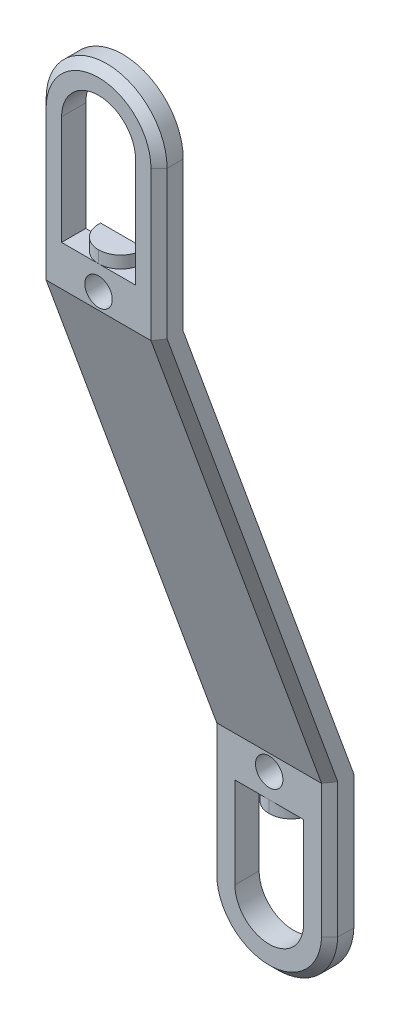
from build123d import *

# Parameters (mm, degrees)
BOSS_EXTRUDE1_DEPTH            = 3
CUT_EXTRUDE1_REACH             = 52.648
SKETCH3_W                      = 5.5
SKETCH3_H                      = 3
BOSS_EXTRUDE2_DEPTH            = 1.5
CUT_EXTRUDE2_REACH             = 52.648
SKETCH4_W                      = 6.851042423
SKETCH4_H                      = 79.503772781
CUT_EXTRUDE2_DIRECTION_2_REACH = 52.648
BOSS_EXTRUDE3_DEPTH            = 7.5
BOSS_EXTRUDE3_DEPTH_BACK       = 7.5
BOSS_EXTRUDE5_DEPTH            = 3
CUT_EXTRUDE3_REACH             = 65.182
SKETCH10_W                     = 5.5
SKETCH10_H                     = 3
BOSS_EXTRUDE6_DEPTH            = 1.5
FILLET2_R                      = 2.75
M3_CLEARANCE_HOLE1_D           = 3.4
M3_CLEARANCE_HOLE1_CSINK_D     = 3.45
M3_CLEARANCE_HOLE1_CSINK_ANGLE = 90
M3_CLEARANCE_HOLE2_D           = 3.4
M3_CLEARANCE_HOLE2_CSINK_D     = 3.45
M3_CLEARANCE_HOLE2_CSINK_ANGLE = 90
CHAMFER2_SIZE                  = 1


with BuildPart() as part:
    # Sketch1 → Boss-Extrude1 (new body)
    with BuildSketch(Plane.XY):
        with BuildLine():
            Line((7.5, 42.5), (7.5, -42.5))
            ThreePointArc((7.5, -42.5), (0, -50), (-7.5, -42.5))
            Line((-7.5, -42.5), (-7.5, 42.5))
            ThreePointArc((-7.5, 42.5), (0, 50), (7.5, 42.5))
        make_face()
    extrude(amount=BOSS_EXTRUDE1_DEPTH)

    # Sketch2 → Cut-Extrude1 (cut, up to next)
    with BuildSketch(Plane.XY.offset(3), mode=Mode.PRIVATE) as cut_extrude1_sk1:
        with BuildLine():
            Line((-4.585044143, 42.5), (-4.585044143, 29))
            Line((-4.585044143, 29), (4.585044143, 29))
            Line((4.585044143, 29), (4.585044143, 42.5))
            ThreePointArc((4.585044143, 42.5), (0, 47.085044143), (-4.585044143, 42.5))
        make_face()
    cut_extrude1_tool1 = extrude(cut_extrude1_sk1.sketch, amount=-CUT_EXTRUDE1_REACH, mode=Mode.PRIVATE) & part.part
    cut_extrude1 = cut_extrude1_tool1.solids().sort_by_distance((0, 37.581163, 3))[0]
    add(cut_extrude1, mode=Mode.SUBTRACT)

    # Sketch3 → Boss-Extrude2 (add)
    with BuildSketch(Plane(origin=(0, 29, 0), x_dir=(1, 0, 0), z_dir=(0, 1, 0))):
        with Locations((0, -1.5)):
            Rectangle(SKETCH3_W, SKETCH3_H)
    boss_extrude2 = extrude(amount=BOSS_EXTRUDE2_DEPTH)

    # Mirror1: Cut-Extrude1, Boss-Extrude2 across plane
    add(cut_extrude1.mirror(Plane.ZX), mode=Mode.SUBTRACT)
    add(boss_extrude2.mirror(Plane.ZX))

    # Sketch4 → Cut-Extrude2 (cut, up to next)
    with BuildSketch(Plane(origin=(0, 0, 0), x_dir=(0, 0, -1), z_dir=(1, 0, 0)), mode=Mode.PRIVATE) as cut_extrude2_sk1:
        with Locations((-3.425521211, -15.751886391)):
            Rectangle(SKETCH4_W, SKETCH4_H)
    cut_extrude2_tool1 = extrude(cut_extrude2_sk1.sketch, amount=-CUT_EXTRUDE2_REACH, mode=Mode.PRIVATE) & part.part
    add(cut_extrude2_tool1.solids().sort_by_distance((0, -15.751886, 3.425521))[0], mode=Mode.SUBTRACT)

    # Sketch4 → Cut-Extrude2 direction 2 (cut, up to next)
    with BuildSketch(Plane(origin=(0, 0, 0), x_dir=(0, 0, -1), z_dir=(1, 0, 0)), mode=Mode.PRIVATE) as cut_extrude2_direction_2_sk1:
        with Locations((-3.425521211, -15.751886391)):
            Rectangle(SKETCH4_W, SKETCH4_H)
    cut_extrude2_direction_2_tool1 = extrude(cut_extrude2_direction_2_sk1.sketch, amount=CUT_EXTRUDE2_DIRECTION_2_REACH, mode=Mode.PRIVATE) & part.part
    add(cut_extrude2_direction_2_tool1.solids().sort_by_distance((0, -15.751886, 3.425521))[0], mode=Mode.SUBTRACT)

    # Sketch5 → Boss-Extrude3 (add, two sides: drawn at the far end of the back side and taken through both)
    with BuildSketch(Plane(origin=(0, 0, 0), x_dir=(0, 0, -1), z_dir=(1, 0, 0)).offset(-BOSS_EXTRUDE3_DEPTH_BACK)):
        Polygon((0, 24), (21.157354182, -34.12935287), (18.157354182, -34.12935287), (-3, 24), align=None)
    extrude(amount=BOSS_EXTRUDE3_DEPTH + BOSS_EXTRUDE3_DEPTH_BACK)

    # Sketch7 → Boss-Extrude5 (add)
    with BuildSketch(Plane.XY.offset(-21.157354182)):
        with BuildLine():
            Line((7.5, -34.12935287), (7.5, -50.62935287))
            ThreePointArc((7.5, -50.62935287), (-0.115167499, -57.896309511), (-7.5, -50.395397313))
            Line((-7.5, -50.395397313), (-7.5, -34.12935287))
            Line((-7.5, -34.12935287), (7.5, -34.12935287))
        make_face()
    extrude(amount=BOSS_EXTRUDE5_DEPTH)

    # Sketch9 → Cut-Extrude3 (cut, up to next)
    with BuildSketch(Plane(origin=(0, 0, -21.157354182), x_dir=(-1, 0, 0), z_dir=(0, 0, -1)), mode=Mode.PRIVATE) as cut_extrude3_sk1:
        with BuildLine():
            Line((-4.25, -39.12935287), (4.25, -39.12935287))
            Line((4.25, -39.12935287), (4.25, -50.395397313))
            ThreePointArc((4.25, -50.395397313), (-0.002513121, -54.647221764), (-4.25364879, -50.394020085))
            Line((-4.25364879, -50.394020085), (-4.25, -39.12935287))
        make_face()
    cut_extrude3_tool1 = extrude(cut_extrude3_sk1.sketch, amount=-CUT_EXTRUDE3_REACH, mode=Mode.PRIVATE) & part.part
    add(cut_extrude3_tool1.solids().sort_by_distance((0.001121, -46.463485, -21.157354))[0], mode=Mode.SUBTRACT)

    # Sketch10 → Boss-Extrude6 (add)
    with BuildSketch(Plane.XZ.offset(39.12935287)):
        with Locations((0, -19.657354182)):
            Rectangle(SKETCH10_W, SKETCH10_H)
    extrude(amount=BOSS_EXTRUDE6_DEPTH)

    # Fillet2
    fillet2_edges = [part.edges().sort_by_distance(p)[0] for p in [
        (2.75, -39.87935287, -18.157354182),
        (-2.75, -39.87935287, -18.157354182),
        (-2.75, 29.75, 3),
        (2.75, 29.75, 3),
    ]]
    fillet(fillet2_edges, radius=FILLET2_R - 0.0001)  # a hair under: the kernel refuses the full size

    # M3 Clearance Hole1 (through all)
    with Locations(Plane(origin=(0, 0, 0), x_dir=(-1, 0, 0), z_dir=(0, 0, -1))):
        with Locations((0, 26)):
            CounterSinkHole(M3_CLEARANCE_HOLE1_D / 2, M3_CLEARANCE_HOLE1_CSINK_D / 2, counter_sink_angle=M3_CLEARANCE_HOLE1_CSINK_ANGLE)

    # M3 Clearance Hole2 (through all)
    with Locations(Plane(origin=(0, 0, -21.157354182), x_dir=(-1, 0, 0), z_dir=(0, 0, -1))):
        with Locations((0, -36.12935287)):
            CounterSinkHole(M3_CLEARANCE_HOLE2_D / 2, M3_CLEARANCE_HOLE2_CSINK_D / 2, counter_sink_angle=M3_CLEARANCE_HOLE2_CSINK_ANGLE)

    # Chamfer2
    chamfer2_edges = [part.edges().sort_by_distance(p)[0] for p in [
        (7.5, -5.064676435, -7.578677091),
        (-7.5, -5.064676435, -7.578677091),
        (-7.5, -42.262375091, -18.157354182),
        (-0.115167499, -57.896309511, -18.157354182),
        (7.5, -42.37935287, -18.157354182),
        (0, 50, 3),
        (7.5, 33.25, 3),
        (-7.5, 33.25, 3),
    ]]
    chamfer(chamfer2_edges, length=CHAMFER2_SIZE)


solid = part.part
